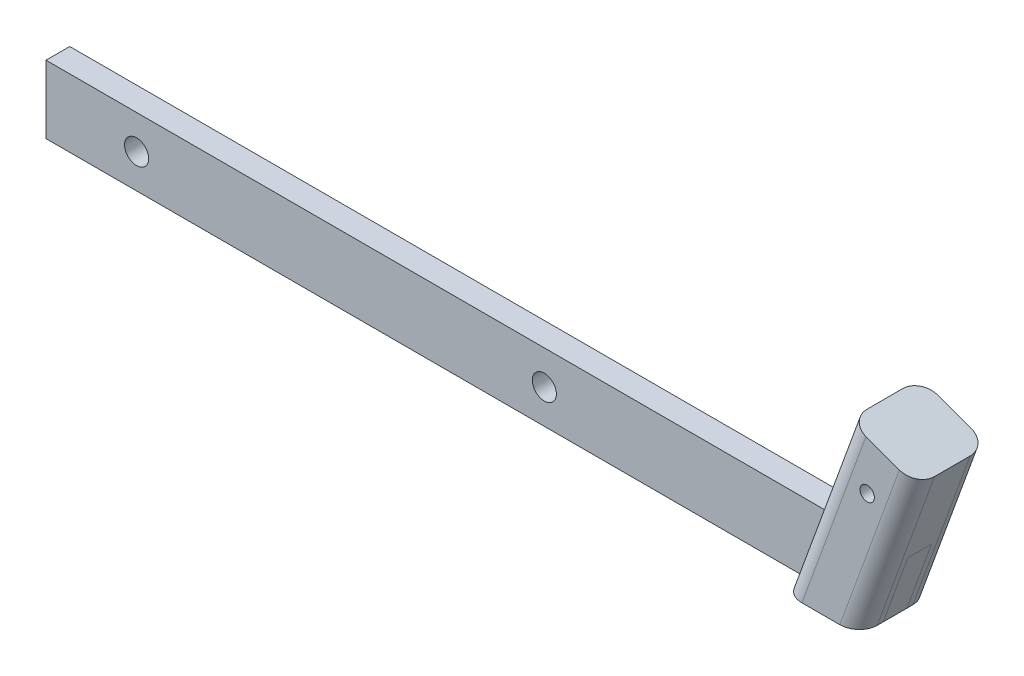
from build123d import *

# Parameters (mm, degrees)
BOSS_EXTRUDE2_REACH              = 81.995
SKETCH9_W                        = 20.1422
SKETCH9_H                        = 20.1422
F_10_32_TAPPED_HOLE1_D           = 4.0386
CUT_EXTRUDE2_REACH               = 260.624
SKETCH11_W                       = 6.6548
SKETCH11_H                       = 19.05
FILLET1_R                        = 5.08
BOSS_EXTRUDE3_REACH              = 260.624
SKETCH11_2_W                     = 6.6548
SKETCH11_2_H                     = 19.05
SKETCH17_W                       = 3.3782
SKETCH17_H                       = 13.3985
F_1_4_CLEARANCE_HOLE1_AT_2_COUNT = 2
F_1_4_CLEARANCE_HOLE1_AT_2_PITCH = 114.3


with BuildPart() as part:
    # Boss-Extrude2: up to this plane
    boss_extrude2_end = Plane(origin=(0, 0, 0), z_dir=(0, 1, 0))
    # Sketch9 → Boss-Extrude2 (new, up to the surface)
    with BuildSketch(Plane(origin=(17.334082407, 47.625, 0), x_dir=(0.939692620785907, -0.34202014332567254, 0), z_dir=(0.34202014332567254, 0.939692620785907, 0)), mode=Mode.PRIVATE) as boss_extrude2_sk1:
        Rectangle(SKETCH9_W, SKETCH9_H)
    boss_extrude2_tool1 = split(extrude(boss_extrude2_sk1.sketch, amount=-BOSS_EXTRUDE2_REACH, mode=Mode.PRIVATE), bisect_by=boss_extrude2_end, keep=Keep.BOTH, mode=Mode.PRIVATE)
    add(boss_extrude2_tool1.solids().sort_by_distance((17.334082, 47.625, 0))[0])

    # #10-32 Tapped Hole1 (through all)
    with Locations(Plane(origin=(0, 0, -10.0711), x_dir=(-1, 0, 0), z_dir=(0, 0, -1))):
        with Locations((-12.990426587, 35.690903716)):
            Hole(F_10_32_TAPPED_HOLE1_D / 2)

    # Cut-Extrude2: up to this plane
    cut_extrude2_end = Plane(origin=(-0.591461061, -31.070952403, -10.0711), z_dir=(0.939692620785907, -0.34202014332567254, 0))
    # Sketch11 → Cut-Extrude2 (cut, up to the surface)
    with BuildSketch(Plane.ZY.offset(223.965917593), mode=Mode.PRIVATE) as cut_extrude2_sk1:
        with Locations((0, 9.525)):
            Rectangle(SKETCH11_W, SKETCH11_H)
    cut_extrude2_tool1 = split(extrude(cut_extrude2_sk1.sketch, amount=-CUT_EXTRUDE2_REACH, mode=Mode.PRIVATE), bisect_by=cut_extrude2_end, keep=Keep.BOTH, mode=Mode.PRIVATE)
    add(cut_extrude2_tool1.solids().sort_by_distance((-223.965918, 9.525, 0))[0], mode=Mode.SUBTRACT)

    # Fillet1
    fillet1_edges = [part.edges().sort_by_distance(p)[0] for p in [
        (18.757630762, 22.090240467, 10.0711),
        (-1.423548355, 25.534759533, 10.0711),
        (-1.423548355, 25.534759533, -10.0711),
        (18.757630762, 22.090240467, -10.0711),
    ]]
    fillet(fillet1_edges, radius=FILLET1_R)


with BuildPart() as body_2:
    # Boss-Extrude3: up to this plane
    boss_extrude3_end = Plane(origin=(-0.591461061, -31.070952403, -10.0711), z_dir=(0.939692620785907, -0.34202014332567254, 0))
    # Sketch11<2> → Boss-Extrude3 (new, up to the surface)
    with BuildSketch(Plane.ZY.offset(223.965917593), mode=Mode.PRIVATE) as boss_extrude3_sk1:
        with Locations((0, 9.525)):
            Rectangle(SKETCH11_2_W, SKETCH11_2_H)
    boss_extrude3_tool1 = split(extrude(boss_extrude3_sk1.sketch, amount=-BOSS_EXTRUDE3_REACH, mode=Mode.PRIVATE), bisect_by=boss_extrude3_end, keep=Keep.BOTH, mode=Mode.PRIVATE)
    add(boss_extrude3_tool1.solids().sort_by_distance((-223.965918, 9.525, 0))[0])

    # Sketch17 → 1/4 Clearance Hole1 (revolve, cut)
    with BuildSketch(Plane(origin=(-84.265917593, 9.525, -3.3274), x_dir=(0, 1, 0), z_dir=(1, 0, 0))):
        with Locations((1.6891, 6.69925)):
            Rectangle(SKETCH17_W, SKETCH17_H)
    f_1_4_clearance_hole1 = revolve(axis=Axis((-84.265917593, 9.525, -9.6774), (0, 0, 1)), mode=Mode.SUBTRACT)

    # 1/4 Clearance Hole1 at 2: 1/4 Clearance Hole1 ×2
    with Locations(*[(-i * F_1_4_CLEARANCE_HOLE1_AT_2_PITCH, 0, 0) for i in range(1, F_1_4_CLEARANCE_HOLE1_AT_2_COUNT)]):
        add(f_1_4_clearance_hole1, mode=Mode.SUBTRACT)


solid = Compound([part.part, body_2.part])
